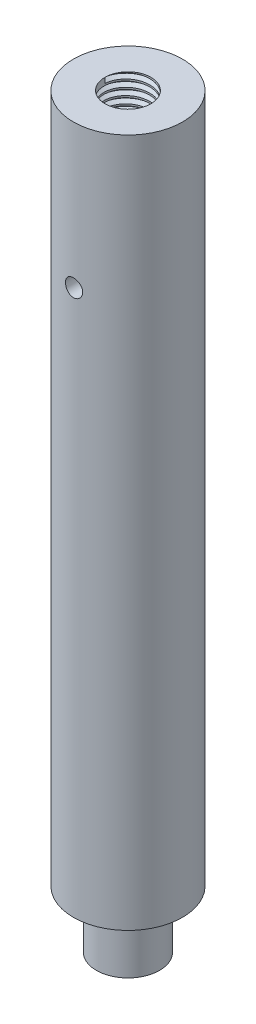
from build123d import *
from build123d.topology import SkipClean

# Parameters (mm, degrees)
CROQUIS1_R                 = 9.5
SALIENTE_EXTRUIR1_DEPTH    = 120
CROQUIS3_R                 = 5.5
SALIENTE_EXTRUIR2_DEPTH    = 10
CROQUIS4_R                 = 2.5
CORTAR_EXTRUIR1_DEPTH      = 110
CORTAR_EXTRUIR2_DEPTH      = 110
CORTAR_EXTRUIR2_DEPTH_BACK = 110
CROQUIS5_R                 = 1.5
CROQUIS6_R                 = 4
CORTAR_EXTRUIR3_DEPTH      = 10
ROSCA1_PITCH               = 1.25


with BuildPart() as part:
    # Croquis1 → Saliente-Extruir1 (new body)
    with BuildSketch(Plane(origin=(0, 0, 0), x_dir=(1, 0, 0), z_dir=(0, 1, 0))):
        with Locations(Location((0, 0, 0), (0, 0, 270))):
            Circle(CROQUIS1_R)
    extrude(amount=SALIENTE_EXTRUIR1_DEPTH)

    # Croquis3 → Saliente-Extruir2 (add)
    with BuildSketch(Plane.XZ):
        with Locations(Location((0, 0, 0), (0, 0, 270))):
            Circle(CROQUIS3_R)
    extrude(amount=SALIENTE_EXTRUIR2_DEPTH)

    # Croquis4 → Cortar-Extruir1 (cut)
    with BuildSketch(Plane.XZ.offset(10)):
        with Locations(Location((0, 0, 0), (0, 0, 270))):
            Circle(CROQUIS4_R)
    extrude(amount=-CORTAR_EXTRUIR1_DEPTH, mode=Mode.SUBTRACT)

    # Croquis5 → Cortar-Extruir2 (cut, two sides: drawn at the far end of the back side and taken through both)
    with BuildSketch(Plane.XY.offset(-CORTAR_EXTRUIR2_DEPTH_BACK)):
        with Locations(Location((0, 95, 0), (0, 0, 180))):
            Circle(CROQUIS5_R)
    extrude(amount=CORTAR_EXTRUIR2_DEPTH + CORTAR_EXTRUIR2_DEPTH_BACK, mode=Mode.SUBTRACT)

    # Croquis6 → Cortar-Extruir3 (cut)
    with BuildSketch(Plane(origin=(0, 120, 0), x_dir=(1, 0, 0), z_dir=(0, 1, 0))):
        with Locations(Location((0, 0, 0), (0, 0, 270))):
            Circle(CROQUIS6_R)
    extrude(amount=-CORTAR_EXTRUIR3_DEPTH, mode=Mode.SUBTRACT)

    # Rosca1: the profile of Perfil de rosca1 profile screwed along a right-hand helix of 8 turns, 8 arcs to a turn; built about Z, then put on its axis
    with SkipClean():  # the faces are left unmerged after this step: merging them gives an invalid solid
        rosca1_z = Axis((0, 0, 0), (0, 0, 1))
        rosca1_corners = [(3.9997, 0, -0.000173205), (4.676582344, 0, 0.390624998), (4.676582344, 0, 0.546874998), (3.9997, 0, 0.937673202)]
        with BuildLine(mode=Mode.PRIVATE) as rosca1_profile:
            Line(rosca1_corners[0], rosca1_corners[1])
            Line(rosca1_corners[1], rosca1_corners[2])
            Line(rosca1_corners[2], rosca1_corners[3])
            Line(rosca1_corners[3], rosca1_corners[0])
        rosca1_cap = Face(rosca1_profile.wire())
        rosca1_turn_angles = [0, 22.5, 45, 67.5, 90, 112.5, 135, 157.5, 180, 202.5, 225, 247.5, 270, 292.5, 315, 337.5, 360]
        rosca1_turn_weights = [1, 0.9238795325112867, 1, 0.9238795325112867, 1, 0.9238795325112867, 1, 0.9238795325112867, 1, 0.9238795325112867, 1, 0.9238795325112867, 1, 0.9238795325112867, 1, 0.9238795325112867, 1]
        rosca1_turn_rails = [Edge.make_bspline([Vector(p[0], p[1], 0).rotate(rosca1_z, rosca1_turn_angles[k]) / rosca1_turn_weights[k] + Vector(0, 0, p[2] + ROSCA1_PITCH * rosca1_turn_angles[k] / 360) for k in range(17)], [0, 0, 0, 1, 1, 2, 2, 3, 3, 4, 4, 5, 5, 6, 6, 7, 7, 8, 8, 8], 2, rosca1_turn_weights) for p in rosca1_corners]
        rosca1_turn_sides = [Face.make_surface_from_curves(rosca1_turn_rails[p[0]], rosca1_turn_rails[p[1]]) for p in [(0, 1), (1, 2), (2, 3), (3, 0)]]
        rosca1 = Plane(origin=(0, 120, 0), x_dir=(-1, 0, 0), z_dir=(0, -1, 0)) * Solid(Shell([*[p.moved(Location((0, 0, ROSCA1_PITCH * i))) for i in range(8) for p in rosca1_turn_sides], rosca1_cap, rosca1_cap.rotate(rosca1_z, 2880).moved(Location((0, 0, ROSCA1_PITCH * 2880 / 360)))]))
        add(rosca1, mode=Mode.SUBTRACT)


solid = part.part
